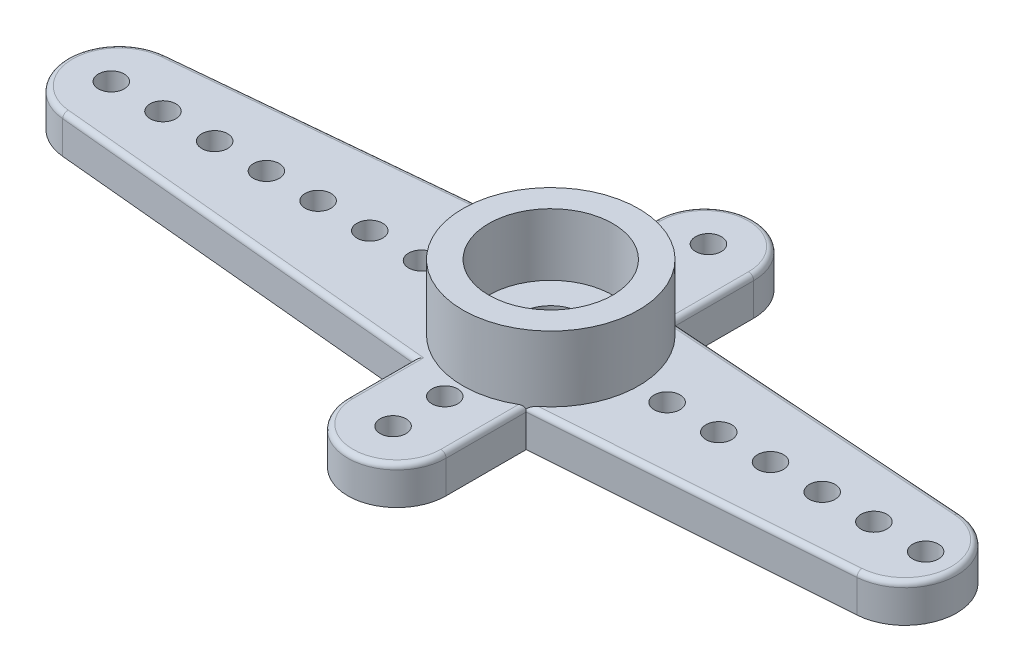
from build123d import *

# Parameters (mm, degrees)
BOSS_EXTRUDE2_START       = -1.46
BOSS_EXTRUDE2_DEPTH       = 1.46
BOSS_EXTRUDE2_2_OUTLINE_R = 3.4
BOSS_EXTRUDE2_2_DEPTH     = 2.54
FILLET1_R                 = 0.2
SKETCH3_R                 = 2.4
CUT_EXTRUDE1_DEPTH        = 2.4
CUT_EXTRUDE2_START        = -1
SKETCH4_R                 = 2.4
CUT_EXTRUDE2_DEPTH        = 1
CUT_EXTRUDE3_REACH        = 22.737
SKETCH5_R                 = 1.2
CUT_EXTRUDE4_REACH        = 22.753
SKETCH6_R                 = 0.5


# Read off the part's stored shape, not the designer's step: Boss-Extrude2
with BuildPart() as part:
    # Boss-Extrude2 outline → Boss-Extrude2 (new body)
    with BuildSketch(Plane(origin=(0, 1.46, 0), x_dir=(1, 0, 0), z_dir=(0, 1, 0)).offset(BOSS_EXTRUDE2_START)):
        with BuildLine():
            ThreePointArc((0, -3.1), (1.9, -5), (3.8, -3.1))
            Line((3.8, -3.1), (3.8, 0))
            Line((3.8, 0), (15.742834343, 0.855106933))
            ThreePointArc((15.742834343, 0.855106933), (17.6, 2.85), (15.742834343, 4.844893067))
            Line((15.742834343, 4.844893067), (3.8, 5.7))
            Line((3.8, 5.7), (3.8, 8.8))
            ThreePointArc((3.8, 8.8), (1.9, 10.7), (0, 8.8))
            Line((0, 8.8), (0, 6.25))
            Line((0, 6.25), (-14.987172698, 4.841222333))
            ThreePointArc((-14.987172698, 4.841222333), (-16.8, 2.85), (-14.987172698, 0.858777667))
            Line((-14.987172698, 0.858777667), (0, -0.55))
            Line((0, -0.55), (0, -3.1))
        make_face()
    extrude(amount=BOSS_EXTRUDE2_DEPTH)

    # Boss-Extrude2 2 outline → Boss-Extrude2 2 (add)
    with BuildSketch(Plane(origin=(0, 1.46, 0), x_dir=(1, 0, 0), z_dir=(0, 1, 0))):
        with Locations((1.9, 2.85)):
            Circle(BOSS_EXTRUDE2_2_OUTLINE_R)
    extrude(amount=BOSS_EXTRUDE2_2_DEPTH)

    # Fillet1
    # the kernel refuses this fillet: 0.2 mm, written as the material it takes off along each edge
    with BuildSketch(Plane(origin=(15.6, 1.46, -2.85), x_dir=(0.0714171712881136, 0, 0.9974465337276001), z_dir=(-0.9974465337276001, 0, 0.0714171712881136))) as fillet1_piece_1:
        with BuildLine():
            CenterArc((2 - FILLET1_R, -FILLET1_R), FILLET1_R, 0, 90)
            Line((2, -FILLET1_R), (2, 0))
            Line((2, 0), (2 - FILLET1_R, 0))
        make_face()
    revolve(axis=Axis((15.6, 1.46, -2.85), (0, 1, 0)), revolution_arc=171.809222188, mode=Mode.SUBTRACT)
    with BuildSketch(Plane(origin=(15.742834343, 1.46, -4.844893067), x_dir=(-0.07141717131707818, 0, 0.9974465337255262), z_dir=(-0.9974465337255262, 0, -0.07141717131707818))) as fillet1_piece_2_section:
        with BuildLine():
            CenterArc((FILLET1_R, -FILLET1_R), FILLET1_R, 90, 90)
            Line((0, -FILLET1_R), (0, 0))
            Line((0, 0), (FILLET1_R, 0))
        make_face()
    fillet1_piece_2 = extrude(amount=12.473408037, mode=Mode.PRIVATE)
    fillet1_piece_2 = fillet1_piece_2 - Plane(origin=(1.9, 1.414610024, -2.85), x_dir=(1, 0, 0), z_dir=(0, -1, 0)) * Cylinder(3.4, 26, mode=Mode.PRIVATE)
    fillet1_piece_2 = split(fillet1_piece_2, bisect_by=Plane(origin=(3.8, 1.414610024, -5.226018326), z_dir=(1, 0, 0)), keep=Keep.TOP, mode=Mode.PRIVATE)
    add(fillet1_piece_2, mode=Mode.SUBTRACT)
    with BuildSketch(Plane(origin=(3.8, 1.46, -5.2), x_dir=(-1, 0, 0), z_dir=(0, 0, -1))) as fillet1_piece_3_section:
        with BuildLine():
            CenterArc((FILLET1_R, -FILLET1_R), FILLET1_R, 90, 90)
            Line((0, -FILLET1_R), (0, 0))
            Line((0, 0), (FILLET1_R, 0))
        make_face()
    fillet1_piece_3 = extrude(amount=3.6, mode=Mode.PRIVATE)
    fillet1_piece_3 = fillet1_piece_3 - Plane(origin=(1.9, 1.414595977, -2.85), x_dir=(1, 0, 0), z_dir=(0, -1, 0)) * Cylinder(3.4, 9, mode=Mode.PRIVATE)
    fillet1_piece_3 = split(fillet1_piece_3, bisect_by=Plane(origin=(3.644376432, 1.414595977, -5.711142647), z_dir=(0.07141717131707818, 0, -0.9974465337255262)), keep=Keep.TOP, mode=Mode.PRIVATE)
    add(fillet1_piece_3, mode=Mode.SUBTRACT)
    with BuildSketch(Plane(origin=(1.9, 1.46, -8.8), x_dir=(1, 0, 0), z_dir=(0, 0, 1))) as fillet1_piece_4:
        with BuildLine():
            CenterArc((1.9 - FILLET1_R, -FILLET1_R), FILLET1_R, 0, 90)
            Line((1.9 - FILLET1_R, 0), (1.9, 0))
            Line((1.9, 0), (1.9, -FILLET1_R))
        make_face()
    revolve(axis=Axis((1.9, 1.46, -8.8), (0, 1, 0)), revolution_arc=180, mode=Mode.SUBTRACT)
    with BuildSketch(Plane(origin=(0, 1.46, -8.8), x_dir=(0, -1, 0), z_dir=(0, 0, 1))) as fillet1_piece_5_section:
        with BuildLine():
            CenterArc((FILLET1_R, FILLET1_R), FILLET1_R, 180, 90)
            Line((0, FILLET1_R), (0, 0))
            Line((0, 0), (FILLET1_R, 0))
        make_face()
    fillet1_piece_5 = extrude(amount=3.05, mode=Mode.PRIVATE)
    fillet1_piece_5 = split(fillet1_piece_5, bisect_by=Plane(origin=(0.163811302, 1.414680425, -6.265398081), z_dir=(-0.09358634913497901, 0, -0.9956111666989207)), keep=Keep.TOP, mode=Mode.PRIVATE)
    add(fillet1_piece_5, mode=Mode.SUBTRACT)
    with BuildSketch(Plane(origin=(0.497805583, 1.46, -6.296793175), x_dir=(0, -1, 0), z_dir=(-0.9956111666989207, 0, 0.09358634913497901))) as fillet1_piece_6_section:
        with BuildLine():
            CenterArc((FILLET1_R, FILLET1_R), FILLET1_R, 180, 90)
            Line((0, FILLET1_R), (0, 0))
            Line((0, 0), (FILLET1_R, 0))
        make_face()
    fillet1_piece_6 = extrude(amount=15.553238854, mode=Mode.PRIVATE)
    fillet1_piece_6 = split(fillet1_piece_6, bisect_by=Plane(origin=(0, 1.414714117, -5.500343318), z_dir=(-1, 0, 0)), keep=Keep.TOP, mode=Mode.PRIVATE)
    add(fillet1_piece_6, mode=Mode.SUBTRACT)
    with BuildSketch(Plane(origin=(-14.8, 1.46, -2.85), x_dir=(-0.09358634878932036, 0, -0.9956111667314121), z_dir=(0.9956111667314121, 0, -0.09358634878932036))) as fillet1_piece_7:
        with BuildLine():
            CenterArc((2 - FILLET1_R, -FILLET1_R), FILLET1_R, 0, 90)
            Line((2, -FILLET1_R), (2, 0))
            Line((2, 0), (2 - FILLET1_R, 0))
        make_face()
    revolve(axis=Axis((-14.8, 1.46, -2.85), (0, 1, 0)), revolution_arc=169.260077878, mode=Mode.SUBTRACT)
    with BuildSketch(Plane(origin=(3.8, 1.46, 3.1), x_dir=(-1, 0, 0), z_dir=(0, 0, -1))) as fillet1_piece_8_section:
        with BuildLine():
            CenterArc((FILLET1_R, -FILLET1_R), FILLET1_R, 90, 90)
            Line((0, -FILLET1_R), (0, 0))
            Line((0, 0), (FILLET1_R, 0))
        make_face()
    fillet1_piece_8 = extrude(amount=3.6, mode=Mode.PRIVATE)
    fillet1_piece_8 = fillet1_piece_8 - Plane(origin=(1.9, 1.414595975, -2.85), x_dir=(1, 0, 0), z_dir=(0, -1, 0)) * Cylinder(3.4, 9, mode=Mode.PRIVATE)
    fillet1_piece_8 = split(fillet1_piece_8, bisect_by=Plane(origin=(3.644376436, 1.414595975, 0.011142647), z_dir=(0.07141717131707817, 0, 0.9974465337255262)), keep=Keep.TOP, mode=Mode.PRIVATE)
    add(fillet1_piece_8, mode=Mode.SUBTRACT)
    with BuildSketch(Plane(origin=(-14.987172698, 1.46, -0.858777667), x_dir=(0.09358634913497903, 0, -0.9956111666989206), z_dir=(0.9956111666989207, 0, 0.09358634913497903))) as fillet1_piece_9_section:
        with BuildLine():
            CenterArc((FILLET1_R, -FILLET1_R), FILLET1_R, 90, 90)
            Line((0, -FILLET1_R), (0, 0))
            Line((0, 0), (FILLET1_R, 0))
        make_face()
    fillet1_piece_9 = extrude(amount=15.553238854, mode=Mode.PRIVATE)
    fillet1_piece_9 = split(fillet1_piece_9, bisect_by=Plane(origin=(0, 1.414714117, -0.199656682), z_dir=(-1, 0, 0)), keep=Keep.TOP, mode=Mode.PRIVATE)
    add(fillet1_piece_9, mode=Mode.SUBTRACT)
    with BuildSketch(Plane(origin=(0, 1.46, 0.05), x_dir=(1, 0, 0), z_dir=(0, 0, 1))) as fillet1_piece_10_section:
        with BuildLine():
            CenterArc((FILLET1_R, -FILLET1_R), FILLET1_R, 90, 90)
            Line((0, -FILLET1_R), (0, 0))
            Line((0, 0), (FILLET1_R, 0))
        make_face()
    fillet1_piece_10 = extrude(amount=3.05, mode=Mode.PRIVATE)
    fillet1_piece_10 = split(fillet1_piece_10, bisect_by=Plane(origin=(0.163811302, 1.414680425, 0.565398081), z_dir=(-0.09358634913497903, 0, 0.9956111666989207)), keep=Keep.TOP, mode=Mode.PRIVATE)
    add(fillet1_piece_10, mode=Mode.SUBTRACT)
    with BuildSketch(Plane(origin=(1.9, 1.46, 3.1), x_dir=(-1, 0, 0), z_dir=(0, 0, -1))) as fillet1_piece_11:
        with BuildLine():
            CenterArc((1.9 - FILLET1_R, -FILLET1_R), FILLET1_R, 0, 90)
            Line((1.9, -FILLET1_R), (1.9, 0))
            Line((1.9, 0), (1.9 - FILLET1_R, 0))
        make_face()
    revolve(axis=Axis((1.9, 1.46, 3.1), (0, 1, 0)), revolution_arc=180, mode=Mode.SUBTRACT)
    with BuildSketch(Plane(origin=(3.301276733, 1.46, 0.035708586), x_dir=(-0.07141717131707817, 0, -0.997446533725526), z_dir=(0.9974465337255262, 0, -0.07141717131707817))) as fillet1_piece_12_section:
        with BuildLine():
            CenterArc((FILLET1_R, -FILLET1_R), FILLET1_R, 90, 90)
            Line((0, -FILLET1_R), (0, 0))
            Line((0, 0), (FILLET1_R, 0))
        make_face()
    fillet1_piece_12 = extrude(amount=12.473408037, mode=Mode.PRIVATE)
    fillet1_piece_12 = fillet1_piece_12 - Plane(origin=(1.9, 1.414610017, -2.85), x_dir=(1, 0, 0), z_dir=(0, -1, 0)) * Cylinder(3.4, 26, mode=Mode.PRIVATE)
    fillet1_piece_12 = split(fillet1_piece_12, bisect_by=Plane(origin=(3.8, 1.414610017, -0.473981762), z_dir=(1, 0, 0)), keep=Keep.TOP, mode=Mode.PRIVATE)
    add(fillet1_piece_12, mode=Mode.SUBTRACT)
    with BuildSketch(Plane(origin=(3.8, 1.46, -5.2), x_dir=(-1, 0, 0), z_dir=(0, 0, -1))) as fillet1_piece_13a_section:
        with BuildLine():
            CenterArc((FILLET1_R, -FILLET1_R), FILLET1_R, 90, 90)
            Line((0, -FILLET1_R), (0, 0))
            Line((0, 0), (FILLET1_R, 0))
        make_face()
    fillet1_piece_13a = extrude(amount=3.6, mode=Mode.PRIVATE)
    fillet1_piece_13a = fillet1_piece_13a - Plane(origin=(1.9, 1.388873643, -2.85), x_dir=(1, 0, 0), z_dir=(0, -1, 0)) * Cylinder(3.4, 9, mode=Mode.PRIVATE)
    fillet1_piece_13a = split(fillet1_piece_13a, bisect_by=Plane(origin=(3.789755805, 1.388873643, -5.700733484), z_dir=(-0.07141717131707818, 0, 0.9974465337255262)), keep=Keep.TOP, mode=Mode.PRIVATE)
    with BuildSketch(Plane(origin=(15.742834343, 1.46, -4.844893067), x_dir=(-0.07141717131707818, 0, 0.9974465337255262), z_dir=(-0.9974465337255262, 0, -0.07141717131707818))) as fillet1_piece_13b_section:
        with BuildLine():
            CenterArc((FILLET1_R, -FILLET1_R), FILLET1_R, 90, 90)
            Line((0, -FILLET1_R), (0, 0))
            Line((0, 0), (FILLET1_R, 0))
        make_face()
    fillet1_piece_13b = extrude(amount=12.473408037, mode=Mode.PRIVATE)
    fillet1_piece_13b = fillet1_piece_13b - Plane(origin=(1.9, 1.381316193, -2.85), x_dir=(1, 0, 0), z_dir=(0, -1, 0)) * Cylinder(3.4, 26, mode=Mode.PRIVATE)
    fillet1_piece_13b = split(fillet1_piece_13b, bisect_by=Plane(origin=(3.8, 1.381316193, -5.695627547), z_dir=(-1, 0, 0)), keep=Keep.TOP, mode=Mode.PRIVATE)
    fillet1_piece_13 = fillet1_piece_13a & fillet1_piece_13b
    add(fillet1_piece_13, mode=Mode.SUBTRACT)
    with BuildSketch(Plane(origin=(0, 1.46, -8.8), x_dir=(0, -1, 0), z_dir=(0, 0, 1))) as fillet1_piece_14a_section:
        with BuildLine():
            CenterArc((FILLET1_R, FILLET1_R), FILLET1_R, 180, 90)
            Line((0, FILLET1_R), (0, 0))
            Line((0, 0), (FILLET1_R, 0))
        make_face()
    fillet1_piece_14a = extrude(amount=3.05, mode=Mode.PRIVATE)
    fillet1_piece_14a = split(fillet1_piece_14a, bisect_by=Plane(origin=(0.02192606, 1.414831105, -6.252061025), z_dir=(0.09358634913497901, 0, 0.9956111666989207)), keep=Keep.TOP, mode=Mode.PRIVATE)
    fillet1_piece_14a = fillet1_piece_14a - Plane(origin=(1.9, 1.414831105, -2.85), x_dir=(1, 0, 0), z_dir=(0, -1, 0)) * Cylinder(3.4, 7, mode=Mode.PRIVATE)
    with BuildSketch(Plane(origin=(0.497805583, 1.46, -6.296793175), x_dir=(0, -1, 0), z_dir=(-0.9956111666989207, 0, 0.09358634913497901))) as fillet1_piece_14b_section:
        with BuildLine():
            CenterArc((FILLET1_R, FILLET1_R), FILLET1_R, 180, 90)
            Line((0, FILLET1_R), (0, 0))
            Line((0, 0), (FILLET1_R, 0))
        make_face()
    fillet1_piece_14b = extrude(amount=15.553238854, mode=Mode.PRIVATE)
    fillet1_piece_14b = split(fillet1_piece_14b, bisect_by=Plane(origin=(0, 1.414925706, -6.227770573), z_dir=(1, 0, 0)), keep=Keep.TOP, mode=Mode.PRIVATE)
    fillet1_piece_14 = fillet1_piece_14a & fillet1_piece_14b
    add(fillet1_piece_14, mode=Mode.SUBTRACT)
    with BuildSketch(Plane(origin=(3.301276733, 1.46, 0.035708586), x_dir=(-0.07141717131707817, 0, -0.997446533725526), z_dir=(0.9974465337255262, 0, -0.07141717131707817))) as fillet1_piece_15a_section:
        with BuildLine():
            CenterArc((FILLET1_R, -FILLET1_R), FILLET1_R, 90, 90)
            Line((0, -FILLET1_R), (0, 0))
            Line((0, 0), (FILLET1_R, 0))
        make_face()
    fillet1_piece_15a = extrude(amount=12.473408037, mode=Mode.PRIVATE)
    fillet1_piece_15a = fillet1_piece_15a - Plane(origin=(1.9, 1.381316193, -2.85), x_dir=(1, 0, 0), z_dir=(0, -1, 0)) * Cylinder(3.4, 26, mode=Mode.PRIVATE)
    fillet1_piece_15a = split(fillet1_piece_15a, bisect_by=Plane(origin=(3.8, 1.381316193, -0.004372453), z_dir=(-1, 0, 0)), keep=Keep.TOP, mode=Mode.PRIVATE)
    with BuildSketch(Plane(origin=(3.8, 1.46, 3.1), x_dir=(-1, 0, 0), z_dir=(0, 0, -1))) as fillet1_piece_15b_section:
        with BuildLine():
            CenterArc((FILLET1_R, -FILLET1_R), FILLET1_R, 90, 90)
            Line((0, -FILLET1_R), (0, 0))
            Line((0, 0), (FILLET1_R, 0))
        make_face()
    fillet1_piece_15b = extrude(amount=3.6, mode=Mode.PRIVATE)
    fillet1_piece_15b = fillet1_piece_15b - Plane(origin=(1.9, 1.388873643, -2.85), x_dir=(1, 0, 0), z_dir=(0, -1, 0)) * Cylinder(3.4, 9, mode=Mode.PRIVATE)
    fillet1_piece_15b = split(fillet1_piece_15b, bisect_by=Plane(origin=(3.789755805, 1.388873643, 0.000733484), z_dir=(-0.07141717131707817, 0, -0.9974465337255262)), keep=Keep.TOP, mode=Mode.PRIVATE)
    fillet1_piece_15 = fillet1_piece_15a & fillet1_piece_15b
    add(fillet1_piece_15, mode=Mode.SUBTRACT)
    with BuildSketch(Plane(origin=(-14.987172698, 1.46, -0.858777667), x_dir=(0.09358634913497903, 0, -0.9956111666989206), z_dir=(0.9956111666989207, 0, 0.09358634913497903))) as fillet1_piece_16a_section:
        with BuildLine():
            CenterArc((FILLET1_R, -FILLET1_R), FILLET1_R, 90, 90)
            Line((0, -FILLET1_R), (0, 0))
            Line((0, 0), (FILLET1_R, 0))
        make_face()
    fillet1_piece_16a = extrude(amount=15.553238854, mode=Mode.PRIVATE)
    fillet1_piece_16a = split(fillet1_piece_16a, bisect_by=Plane(origin=(0, 1.414925706, 0.527770573), z_dir=(1, 0, 0)), keep=Keep.TOP, mode=Mode.PRIVATE)
    with BuildSketch(Plane(origin=(0, 1.46, 0.05), x_dir=(1, 0, 0), z_dir=(0, 0, 1))) as fillet1_piece_16b_section:
        with BuildLine():
            CenterArc((FILLET1_R, -FILLET1_R), FILLET1_R, 90, 90)
            Line((0, -FILLET1_R), (0, 0))
            Line((0, 0), (FILLET1_R, 0))
        make_face()
    fillet1_piece_16b = extrude(amount=3.05, mode=Mode.PRIVATE)
    fillet1_piece_16b = fillet1_piece_16b - Plane(origin=(1.9, 1.414831105, -2.85), x_dir=(1, 0, 0), z_dir=(0, -1, 0)) * Cylinder(3.4, 7, mode=Mode.PRIVATE)
    fillet1_piece_16b = split(fillet1_piece_16b, bisect_by=Plane(origin=(0.02192606, 1.414831105, 0.552061025), z_dir=(0.09358634913497903, 0, -0.9956111666989207)), keep=Keep.TOP, mode=Mode.PRIVATE)
    fillet1_piece_16 = fillet1_piece_16a & fillet1_piece_16b
    add(fillet1_piece_16, mode=Mode.SUBTRACT)

    # Sketch3 → Cut-Extrude1 (cut)
    with BuildSketch(Plane(origin=(0, 4, 0), x_dir=(1, 0, 0), z_dir=(0, 1, 0))):
        with Locations(Location((1.9, 2.85, 0), (0, 0, 270))):
            Circle(SKETCH3_R)
    extrude(amount=-CUT_EXTRUDE1_DEPTH, mode=Mode.SUBTRACT)

    # Sketch4 → Cut-Extrude2 (cut)
    with BuildSketch(Plane.XZ.offset(CUT_EXTRUDE2_START)):
        with Locations(Location((1.9, -2.85, 0), (0, 0, 90))):
            Circle(SKETCH4_R)
    extrude(amount=CUT_EXTRUDE2_DEPTH, mode=Mode.SUBTRACT)

    # Sketch5 → Cut-Extrude3 (cut, up to next)
    with BuildSketch(Plane(origin=(0, 1.6, 0), x_dir=(1, 0, 0), z_dir=(0, 1, 0)), mode=Mode.PRIVATE) as cut_extrude3_sk1:
        with Locations(Location((1.9, 2.85, 0), (0, 0, 270))):
            Circle(SKETCH5_R)
    cut_extrude3_tool1 = extrude(cut_extrude3_sk1.sketch, amount=-CUT_EXTRUDE3_REACH, mode=Mode.PRIVATE) & part.part
    add(cut_extrude3_tool1.solids().sort_by_distance((1.9, 1.6, -2.85))[0], mode=Mode.SUBTRACT)

    # Sketch6 → Cut-Extrude4 (cut, up to next)
    with BuildSketch(Plane(origin=(0, 1.46, 0), x_dir=(1, 0, 0), z_dir=(0, 1, 0)), mode=Mode.PRIVATE) as cut_extrude4_sk1:
        with Locations(Location((6.4, 2.85, 0), (0, 0, 270))):
            Circle(SKETCH6_R)
    cut_extrude4_tool1 = extrude(cut_extrude4_sk1.sketch, amount=-CUT_EXTRUDE4_REACH, mode=Mode.PRIVATE) & part.part
    # Sketch6 → Cut-Extrude4 (cut, up to next)
    with BuildSketch(Plane(origin=(0, 1.46, 0), x_dir=(1, 0, 0), z_dir=(0, 1, 0)), mode=Mode.PRIVATE) as cut_extrude4_sk2:
        with Locations(Location((8.4, 2.85, 0), (0, 0, 270))):
            Circle(SKETCH6_R)
    cut_extrude4_tool2 = extrude(cut_extrude4_sk2.sketch, amount=-CUT_EXTRUDE4_REACH, mode=Mode.PRIVATE) & part.part
    # Sketch6 → Cut-Extrude4 (cut, up to next)
    with BuildSketch(Plane(origin=(0, 1.46, 0), x_dir=(1, 0, 0), z_dir=(0, 1, 0)), mode=Mode.PRIVATE) as cut_extrude4_sk3:
        with Locations(Location((10.4, 2.85, 0), (0, 0, 270))):
            Circle(SKETCH6_R)
    cut_extrude4_tool3 = extrude(cut_extrude4_sk3.sketch, amount=-CUT_EXTRUDE4_REACH, mode=Mode.PRIVATE) & part.part
    # Sketch6 → Cut-Extrude4 (cut, up to next)
    with BuildSketch(Plane(origin=(0, 1.46, 0), x_dir=(1, 0, 0), z_dir=(0, 1, 0)), mode=Mode.PRIVATE) as cut_extrude4_sk4:
        with Locations(Location((12.4, 2.85, 0), (0, 0, 270))):
            Circle(SKETCH6_R)
    cut_extrude4_tool4 = extrude(cut_extrude4_sk4.sketch, amount=-CUT_EXTRUDE4_REACH, mode=Mode.PRIVATE) & part.part
    # Sketch6 → Cut-Extrude4 (cut, up to next)
    with BuildSketch(Plane(origin=(0, 1.46, 0), x_dir=(1, 0, 0), z_dir=(0, 1, 0)), mode=Mode.PRIVATE) as cut_extrude4_sk5:
        with Locations(Location((14.4, 2.85, 0), (0, 0, 270))):
            Circle(SKETCH6_R)
    cut_extrude4_tool5 = extrude(cut_extrude4_sk5.sketch, amount=-CUT_EXTRUDE4_REACH, mode=Mode.PRIVATE) & part.part
    # Sketch6 → Cut-Extrude4 (cut, up to next)
    with BuildSketch(Plane(origin=(0, 1.46, 0), x_dir=(1, 0, 0), z_dir=(0, 1, 0)), mode=Mode.PRIVATE) as cut_extrude4_sk6:
        with Locations(Location((16.4, 2.85, 0), (0, 0, 270))):
            Circle(SKETCH6_R)
    cut_extrude4_tool6 = extrude(cut_extrude4_sk6.sketch, amount=-CUT_EXTRUDE4_REACH, mode=Mode.PRIVATE) & part.part
    # Sketch6 → Cut-Extrude4 (cut, up to next)
    with BuildSketch(Plane(origin=(0, 1.46, 0), x_dir=(1, 0, 0), z_dir=(0, 1, 0)), mode=Mode.PRIVATE) as cut_extrude4_sk7:
        with Locations(Location((-3.1, 2.85, 0), (0, 0, 270))):
            Circle(SKETCH6_R)
    cut_extrude4_tool7 = extrude(cut_extrude4_sk7.sketch, amount=-CUT_EXTRUDE4_REACH, mode=Mode.PRIVATE) & part.part
    # Sketch6 → Cut-Extrude4 (cut, up to next)
    with BuildSketch(Plane(origin=(0, 1.46, 0), x_dir=(1, 0, 0), z_dir=(0, 1, 0)), mode=Mode.PRIVATE) as cut_extrude4_sk8:
        with Locations(Location((-5.1, 2.85, 0), (0, 0, 270))):
            Circle(SKETCH6_R)
    cut_extrude4_tool8 = extrude(cut_extrude4_sk8.sketch, amount=-CUT_EXTRUDE4_REACH, mode=Mode.PRIVATE) & part.part
    # Sketch6 → Cut-Extrude4 (cut, up to next)
    with BuildSketch(Plane(origin=(0, 1.46, 0), x_dir=(1, 0, 0), z_dir=(0, 1, 0)), mode=Mode.PRIVATE) as cut_extrude4_sk9:
        with Locations(Location((-7.1, 2.85, 0), (0, 0, 270))):
            Circle(SKETCH6_R)
    cut_extrude4_tool9 = extrude(cut_extrude4_sk9.sketch, amount=-CUT_EXTRUDE4_REACH, mode=Mode.PRIVATE) & part.part
    # Sketch6 → Cut-Extrude4 (cut, up to next)
    with BuildSketch(Plane(origin=(0, 1.46, 0), x_dir=(1, 0, 0), z_dir=(0, 1, 0)), mode=Mode.PRIVATE) as cut_extrude4_sk10:
        with Locations(Location((-9.1, 2.85, 0), (0, 0, 270))):
            Circle(SKETCH6_R)
    cut_extrude4_tool10 = extrude(cut_extrude4_sk10.sketch, amount=-CUT_EXTRUDE4_REACH, mode=Mode.PRIVATE) & part.part
    # Sketch6 → Cut-Extrude4 (cut, up to next)
    with BuildSketch(Plane(origin=(0, 1.46, 0), x_dir=(1, 0, 0), z_dir=(0, 1, 0)), mode=Mode.PRIVATE) as cut_extrude4_sk11:
        with Locations(Location((-11.1, 2.85, 0), (0, 0, 270))):
            Circle(SKETCH6_R)
    cut_extrude4_tool11 = extrude(cut_extrude4_sk11.sketch, amount=-CUT_EXTRUDE4_REACH, mode=Mode.PRIVATE) & part.part
    # Sketch6 → Cut-Extrude4 (cut, up to next)
    with BuildSketch(Plane(origin=(0, 1.46, 0), x_dir=(1, 0, 0), z_dir=(0, 1, 0)), mode=Mode.PRIVATE) as cut_extrude4_sk12:
        with Locations(Location((-13.1, 2.85, 0), (0, 0, 270))):
            Circle(SKETCH6_R)
    cut_extrude4_tool12 = extrude(cut_extrude4_sk12.sketch, amount=-CUT_EXTRUDE4_REACH, mode=Mode.PRIVATE) & part.part
    # Sketch6 → Cut-Extrude4 (cut, up to next)
    with BuildSketch(Plane(origin=(0, 1.46, 0), x_dir=(1, 0, 0), z_dir=(0, 1, 0)), mode=Mode.PRIVATE) as cut_extrude4_sk13:
        with Locations(Location((-15.1, 2.85, 0), (0, 0, 270))):
            Circle(SKETCH6_R)
    cut_extrude4_tool13 = extrude(cut_extrude4_sk13.sketch, amount=-CUT_EXTRUDE4_REACH, mode=Mode.PRIVATE) & part.part
    # Sketch6 → Cut-Extrude4 (cut, up to next)
    with BuildSketch(Plane(origin=(0, 1.46, 0), x_dir=(1, 0, 0), z_dir=(0, 1, 0)), mode=Mode.PRIVATE) as cut_extrude4_sk14:
        with Locations(Location((1.9, 6.95, 0), (0, 0, 270))):
            Circle(SKETCH6_R)
    cut_extrude4_tool14 = extrude(cut_extrude4_sk14.sketch, amount=-CUT_EXTRUDE4_REACH, mode=Mode.PRIVATE) & part.part
    # Sketch6 → Cut-Extrude4 (cut, up to next)
    with BuildSketch(Plane(origin=(0, 1.46, 0), x_dir=(1, 0, 0), z_dir=(0, 1, 0)), mode=Mode.PRIVATE) as cut_extrude4_sk15:
        with Locations(Location((1.9, 8.95, 0), (0, 0, 270))):
            Circle(SKETCH6_R)
    cut_extrude4_tool15 = extrude(cut_extrude4_sk15.sketch, amount=-CUT_EXTRUDE4_REACH, mode=Mode.PRIVATE) & part.part
    # Sketch6 → Cut-Extrude4 (cut, up to next)
    with BuildSketch(Plane(origin=(0, 1.46, 0), x_dir=(1, 0, 0), z_dir=(0, 1, 0)), mode=Mode.PRIVATE) as cut_extrude4_sk16:
        with Locations(Location((1.9, -1.25, 0), (0, 0, 270))):
            Circle(SKETCH6_R)
    cut_extrude4_tool16 = extrude(cut_extrude4_sk16.sketch, amount=-CUT_EXTRUDE4_REACH, mode=Mode.PRIVATE) & part.part
    # Sketch6 → Cut-Extrude4 (cut, up to next)
    with BuildSketch(Plane(origin=(0, 1.46, 0), x_dir=(1, 0, 0), z_dir=(0, 1, 0)), mode=Mode.PRIVATE) as cut_extrude4_sk17:
        with Locations(Location((1.9, -3.25, 0), (0, 0, 270))):
            Circle(SKETCH6_R)
    cut_extrude4_tool17 = extrude(cut_extrude4_sk17.sketch, amount=-CUT_EXTRUDE4_REACH, mode=Mode.PRIVATE) & part.part
    add(cut_extrude4_tool1.solids().sort_by_distance((6.4, 1.46, -2.85))[0], mode=Mode.SUBTRACT)
    add(cut_extrude4_tool2.solids().sort_by_distance((8.4, 1.46, -2.85))[0], mode=Mode.SUBTRACT)
    add(cut_extrude4_tool3.solids().sort_by_distance((10.4, 1.46, -2.85))[0], mode=Mode.SUBTRACT)
    add(cut_extrude4_tool4.solids().sort_by_distance((12.4, 1.46, -2.85))[0], mode=Mode.SUBTRACT)
    add(cut_extrude4_tool5.solids().sort_by_distance((14.4, 1.46, -2.85))[0], mode=Mode.SUBTRACT)
    add(cut_extrude4_tool6.solids().sort_by_distance((16.4, 1.46, -2.85))[0], mode=Mode.SUBTRACT)
    add(cut_extrude4_tool7.solids().sort_by_distance((-3.1, 1.46, -2.85))[0], mode=Mode.SUBTRACT)
    add(cut_extrude4_tool8.solids().sort_by_distance((-5.1, 1.46, -2.85))[0], mode=Mode.SUBTRACT)
    add(cut_extrude4_tool9.solids().sort_by_distance((-7.1, 1.46, -2.85))[0], mode=Mode.SUBTRACT)
    add(cut_extrude4_tool10.solids().sort_by_distance((-9.1, 1.46, -2.85))[0], mode=Mode.SUBTRACT)
    add(cut_extrude4_tool11.solids().sort_by_distance((-11.1, 1.46, -2.85))[0], mode=Mode.SUBTRACT)
    add(cut_extrude4_tool12.solids().sort_by_distance((-13.1, 1.46, -2.85))[0], mode=Mode.SUBTRACT)
    add(cut_extrude4_tool13.solids().sort_by_distance((-15.1, 1.46, -2.85))[0], mode=Mode.SUBTRACT)
    add(cut_extrude4_tool14.solids().sort_by_distance((1.9, 1.46, -6.95))[0], mode=Mode.SUBTRACT)
    add(cut_extrude4_tool15.solids().sort_by_distance((1.9, 1.46, -8.95))[0], mode=Mode.SUBTRACT)
    add(cut_extrude4_tool16.solids().sort_by_distance((1.9, 1.46, 1.25))[0], mode=Mode.SUBTRACT)
    add(cut_extrude4_tool17.solids().sort_by_distance((1.9, 1.46, 3.25))[0], mode=Mode.SUBTRACT)


solid = part.part
